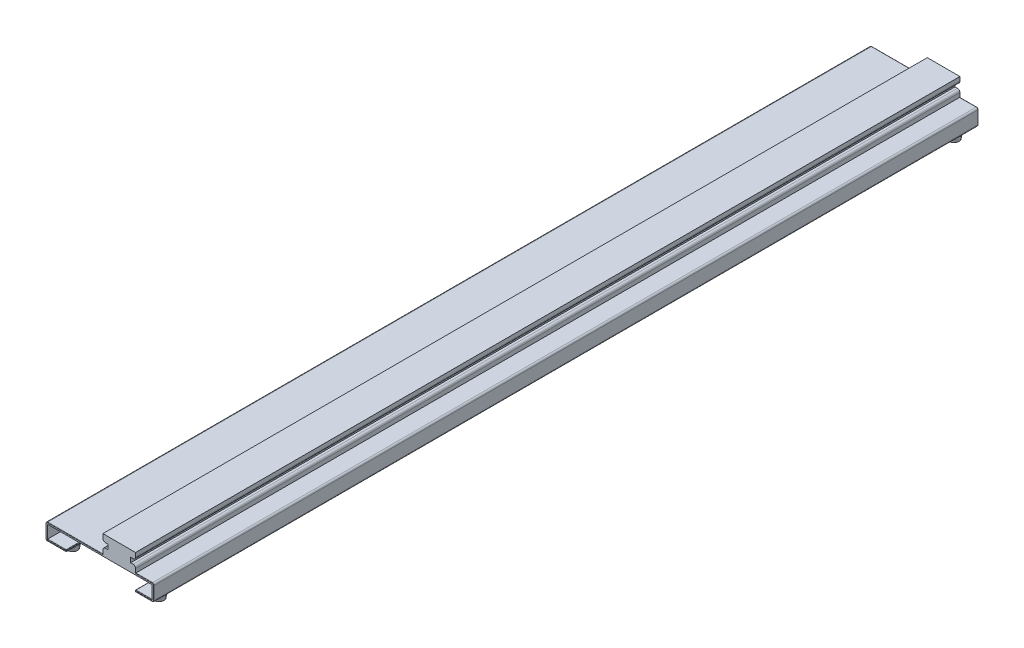
from build123d import *

# Parameters (mm, degrees)
EXTRUDE_1_DEPTH = 1010
FILLET_1_R      = 2
FILLET_2_R      = 0.5
FILLET_3_R      = 0.5
FILLET_4_R      = 3


with BuildPart() as part:
    # 草图1 → 凸台-拉伸1 (new body)
    with BuildSketch(Plane.XY):
        Polygon((-52, 0), (-27, 0), (-27, 2), (-50, 2), (-50, 18), (78.43916289, 18), (78.43916289, 2), (57.650269721, 2), (57.650269721, 0), (80.43916289, 0), (80.43916289, 20), (58, 20), (58, 28), (52, 28), (52, 34), (58, 34), (58, 42), (18, 42), (18, 34), (24, 34), (24, 28), (18, 28), (18, 20), (-52, 20), align=None)
    extrude(amount=-EXTRUDE_1_DEPTH)

    # 圆角1
    fillet_1_edges = [part.edges().sort_by_distance(p)[0] for p in [
        (80.43916289, 20, -505),
        (80.43916289, 0, -505),
        (-52, 0, -505),
        (-52, 20, -505),
    ]]
    fillet(fillet_1_edges, radius=FILLET_1_R)

    # 圆角2
    fillet_2_edges = [part.edges().sort_by_distance(p)[0] for p in [
        (57.650269721, 0, -505),
        (57.650269721, 2, -505),
        (-27, 2, -505),
        (-27, 0, -505),
    ]]
    fillet(fillet_2_edges, radius=FILLET_2_R)

    # 圆角3
    fillet_3_edges = [part.edges().sort_by_distance(p)[0] for p in [
        (57.650269721, 1, 0),
        (57.650269721, 1, -1010),
        (-38.75, 0, 0),
        (-27, 1, 0),
        (-38.75, 2, 0),
        (-27.146446609, 1.853553391, 0),
        (-27.146446609, 0.146446609, 0),
        (57.79671633, 1.853553391, 0),
        (57.79671633, 0.146446609, 0),
        (-38.75, 2, -1010),
        (-27, 1, -1010),
        (-38.75, 0, -1010),
        (-27.146446609, 1.853553391, -1010),
        (-27.146446609, 0.146446609, -1010),
        (57.79671633, 1.853553391, -1010),
        (57.79671633, 0.146446609, -1010),
        (68.294716305, 2, -1010),
        (68.219581445, 20, -1010),
        (68.294716305, 2, 0),
        (68.219581445, 20, 0),
        (68.294716305, 0, 0),
        (68.294716305, 0, -1010),
        (-16, 20, 0),
        (-52, 10, 0),
        (80.43916289, 10, 0),
        (-51.414213562, 19.414213562, 0),
        (-51.414213562, 0.585786438, 0),
        (79.853376452, 19.414213562, 0),
        (79.853376452, 0.585786438, 0),
        (80.43916289, 10, -1010),
        (-52, 10, -1010),
        (-16, 20, -1010),
        (-51.414213562, 19.414213562, -1010),
        (-51.414213562, 0.585786438, -1010),
        (79.853376452, 19.414213562, -1010),
        (79.853376452, 0.585786438, -1010),
    ]]
    fillet(fillet_3_edges, radius=FILLET_3_R)

    # 圆角4
    fillet_4_edges = [part.edges().sort_by_distance(p)[0] for p in [
        (58, 34, -505),
        (58, 28, -505),
        (18, 28, -505),
        (18, 34, -505),
    ]]
    fillet(fillet_4_edges, radius=FILLET_4_R)

    # 放样1: read off the stored shape, not the designer's step
    # 放样1: loft between two sections, ruled curve by curve
    loft_1_from = [
        Edge.make_bspline([(70.846246082, -10, -13.004005958), (81.838234165, -10, -17.818172342), (77.024067781, -10, -28.810160426), (66.032079698, -10, -23.995994042), (55.040091614, -10, -19.181827658), (59.854257998, -10, -8.189839574), (70.846246082, -10, -13.004005958)], [0, 0, 0, 0, 0.5, 0.5, 0.5, 1, 1, 1, 1], 3, [1, 0.333333333, 0.333333333, 1, 0.333333333, 0.333333333, 1]),
    ]
    loft_1_to = [
        Edge.make_bspline([(68.192900935, 0, -10.503791208), (84.185318519, 0, -10.011267297), (84.67784243, 0, -26.003684881), (68.685424845, 0, -26.496208792), (52.693007261, 0, -26.988732703), (52.20048335, 0, -10.996315119), (68.192900935, 0, -10.503791208)], [0, 0, 0, 0, 0.5, 0.5, 0.5, 1, 1, 1, 1], 3, [1, 0.333333333, 0.333333333, 1, 0.333333333, 0.333333333, 1]),
    ]
    loft_1 = Solid(Shell([*[Face.make_surface_from_curves(loft_1_from[k], loft_1_to[k]) for k in range(1)], Face(Wire(loft_1_from)), Face(Wire(loft_1_to))]))
    add(loft_1)

    # 阵列(线性)1: read off the stored shape, not the designer's step
    # 阵列(线性)1: loft between two sections, ruled curve by curve
    pattern_linear_1_from = [
        Edge.make_bspline([(70.846246082, -10, -987.004005958), (81.838234165, -10, -991.818172342), (77.024067781, -10, -1002.810160426), (66.032079698, -10, -997.995994042), (55.040091614, -10, -993.181827658), (59.854257998, -10, -982.189839574), (70.846246082, -10, -987.004005958)], [0, 0, 0, 0, 0.5, 0.5, 0.5, 1, 1, 1, 1], 3, [1, 0.333333333, 0.333333333, 1, 0.333333333, 0.333333333, 1]),
    ]
    pattern_linear_1_to = [
        Edge.make_bspline([(68.192900935, 0, -984.503791208), (84.185318519, 0, -984.011267297), (84.67784243, 0, -1000.003684881), (68.685424845, 0, -1000.496208792), (52.693007261, 0, -1000.988732703), (52.20048335, 0, -984.996315119), (68.192900935, 0, -984.503791208)], [0, 0, 0, 0, 0.5, 0.5, 0.5, 1, 1, 1, 1], 3, [1, 0.333333333, 0.333333333, 1, 0.333333333, 0.333333333, 1]),
    ]
    pattern_linear_1 = Solid(Shell([*[Face.make_surface_from_curves(pattern_linear_1_from[k], pattern_linear_1_to[k]) for k in range(1)], Face(Wire(pattern_linear_1_from)), Face(Wire(pattern_linear_1_to))]))
    add(pattern_linear_1)

    # Pattern Linear 1 2: loft between two sections, ruled curve by curve
    pattern_linear_1_2_from = [
        Edge.make_bspline([(-35.153753918, -10, -13.004005958), (-24.161765835, -10, -17.818172342), (-28.975932219, -10, -28.810160426), (-39.967920302, -10, -23.995994042), (-50.959908386, -10, -19.181827658), (-46.145742002, -10, -8.189839574), (-35.153753918, -10, -13.004005958)], [0, 0, 0, 0, 0.5, 0.5, 0.5, 1, 1, 1, 1], 3, [1, 0.333333333, 0.333333333, 1, 0.333333333, 0.333333333, 1]),
    ]
    pattern_linear_1_2_to = [
        Edge.make_bspline([(-37.807099065, 0, -10.503791208), (-21.814681481, 0, -10.011267297), (-21.32215757, 0, -26.003684881), (-37.314575155, 0, -26.496208792), (-53.306992739, 0, -26.988732703), (-53.79951665, 0, -10.996315119), (-37.807099065, 0, -10.503791208)], [0, 0, 0, 0, 0.5, 0.5, 0.5, 1, 1, 1, 1], 3, [1, 0.333333333, 0.333333333, 1, 0.333333333, 0.333333333, 1]),
    ]
    pattern_linear_1_2 = Solid(Shell([*[Face.make_surface_from_curves(pattern_linear_1_2_from[k], pattern_linear_1_2_to[k]) for k in range(1)], Face(Wire(pattern_linear_1_2_from)), Face(Wire(pattern_linear_1_2_to))]))
    add(pattern_linear_1_2)

    # Pattern Linear 1 3: loft between two sections, ruled curve by curve
    pattern_linear_1_3_from = [
        Edge.make_bspline([(-35.153753918, -10, -987.004005958), (-24.161765835, -10, -991.818172342), (-28.975932219, -10, -1002.810160426), (-39.967920302, -10, -997.995994042), (-50.959908386, -10, -993.181827658), (-46.145742002, -10, -982.189839574), (-35.153753918, -10, -987.004005958)], [0, 0, 0, 0, 0.5, 0.5, 0.5, 1, 1, 1, 1], 3, [1, 0.333333333, 0.333333333, 1, 0.333333333, 0.333333333, 1]),
    ]
    pattern_linear_1_3_to = [
        Edge.make_bspline([(-37.807099065, 0, -984.503791208), (-21.814681481, 0, -984.011267297), (-21.32215757, 0, -1000.003684881), (-37.314575155, 0, -1000.496208792), (-53.306992739, 0, -1000.988732703), (-53.79951665, 0, -984.996315119), (-37.807099065, 0, -984.503791208)], [0, 0, 0, 0, 0.5, 0.5, 0.5, 1, 1, 1, 1], 3, [1, 0.333333333, 0.333333333, 1, 0.333333333, 0.333333333, 1]),
    ]
    pattern_linear_1_3 = Solid(Shell([*[Face.make_surface_from_curves(pattern_linear_1_3_from[k], pattern_linear_1_3_to[k]) for k in range(1)], Face(Wire(pattern_linear_1_3_from)), Face(Wire(pattern_linear_1_3_to))]))
    add(pattern_linear_1_3)


solid = part.part
